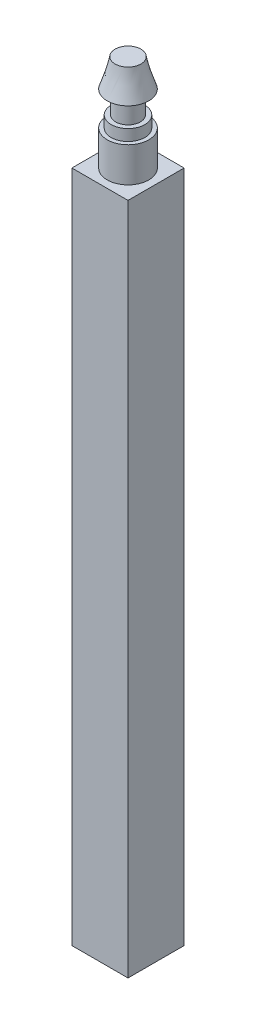
from build123d import *

# Parameters (mm, degrees)
SKETCH1_R           = 1.85
BOSS_EXTRUDE1_DEPTH = 3.1
SKETCH2_R           = 1.5
BOSS_EXTRUDE2_DEPTH = 1
SKETCH3_R           = 1.1
BOSS_EXTRUDE3_DEPTH = 2
SKETCH6_W           = 5
SKETCH6_H           = 5
BOSS_EXTRUDE4_DEPTH = 60
SKETCH7_R           = 1
CUT_EXTRUDE1_DEPTH  = 24


with BuildPart() as part:
    # Sketch1 → Boss-Extrude1 (new body)
    with BuildSketch(Plane(origin=(0, 0, 0), x_dir=(1, 0, 0), z_dir=(0, 1, 0))):
        with Locations(Location((0, 0, 0), (0, 0, 90))):
            Circle(SKETCH1_R)
    extrude(amount=BOSS_EXTRUDE1_DEPTH)

    # Sketch2 → Boss-Extrude2 (add)
    with BuildSketch(Plane(origin=(0, 3.1, 0), x_dir=(1, 0, 0), z_dir=(0, 1, 0))):
        with Locations(Location((0, 0, 0), (0, 0, 270))):
            Circle(SKETCH2_R)
    extrude(amount=BOSS_EXTRUDE2_DEPTH)

    # Sketch3 → Boss-Extrude3 (add)
    with BuildSketch(Plane(origin=(0, 4.1, 0), x_dir=(1, 0, 0), z_dir=(0, 1, 0))):
        with Locations(Location((0, 0, 0), (0, 0, 270))):
            Circle(SKETCH3_R)
    extrude(amount=BOSS_EXTRUDE3_DEPTH)

    # Loft1: read off the stored shape, not the designer's step
    # Loft1: loft between two sections, ruled curve by curve
    loft1_from = [
        Edge.make_bspline([(0, 6.1, 1.85), (3.7, 6.1, 1.85), (3.7, 6.1, -1.85), (0, 6.1, -1.85), (-3.7, 6.1, -1.85), (-3.7, 6.1, 1.85), (0, 6.1, 1.85)], [0, 0, 0, 0, 0.5, 0.5, 0.5, 1, 1, 1, 1], 3, [1, 0.333333333, 0.333333333, 1, 0.333333333, 0.333333333, 1]),
    ]
    loft1_to = [
        Edge.make_bspline([(0.620465421, 8.6, 0.968257539), (2.556980499, 8.6, -0.272673303), (1.316049657, 8.6, -2.209188381), (-0.620465421, 8.6, -0.968257539), (-2.556980499, 8.6, 0.272673303), (-1.316049657, 8.6, 2.209188381), (0.620465421, 8.6, 0.968257539)], [0, 0, 0, 0, 0.5, 0.5, 0.5, 1, 1, 1, 1], 3, [1, 0.333333333, 0.333333333, 1, 0.333333333, 0.333333333, 1]),
    ]
    loft1 = Solid(Shell([*[Face.make_surface_from_curves(loft1_from[k], loft1_to[k]) for k in range(1)], Face(Wire(loft1_from)), Face(Wire(loft1_to))]))
    add(loft1)

    # Sketch6 → Boss-Extrude4 (add)
    with BuildSketch(Plane.XZ):
        Rectangle(SKETCH6_W, SKETCH6_H)
    extrude(amount=BOSS_EXTRUDE4_DEPTH)

    # Sketch7 → Cut-Extrude1 (cut)
    with BuildSketch(Plane.XZ.offset(60)):
        with Locations(Location((0, 0, 0), (0, 0, 270))):
            Circle(SKETCH7_R)
    extrude(amount=-CUT_EXTRUDE1_DEPTH, mode=Mode.SUBTRACT)


solid = part.part
